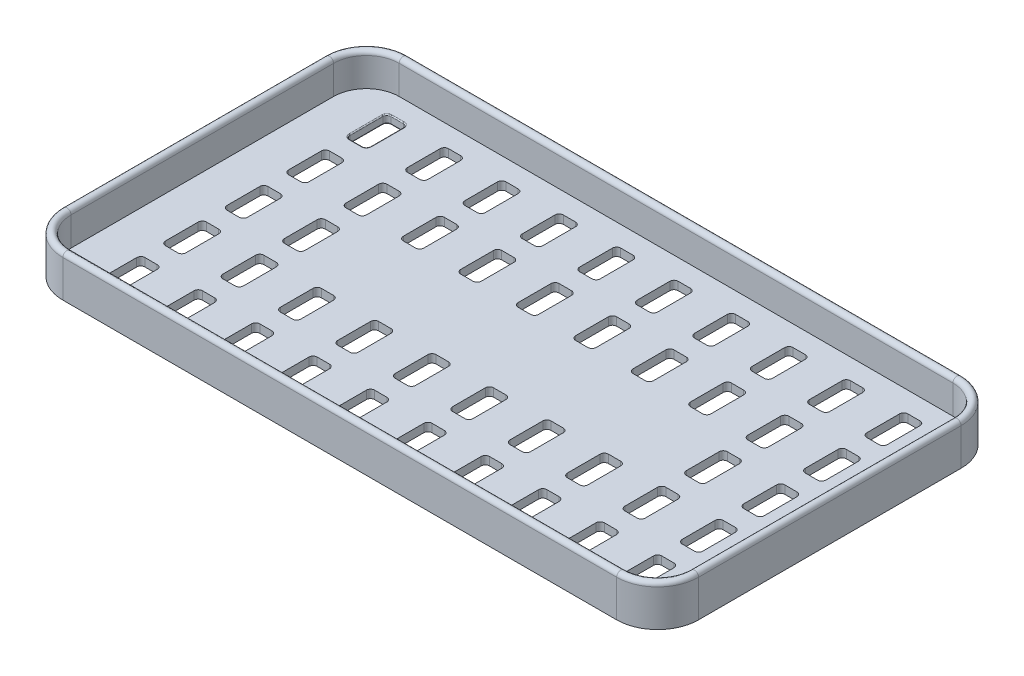
from build123d import *

# Parameters (mm, degrees)
SKETCH1_W              = 155
SKETCH1_H              = 84
BOSS_EXTRUDE1_DEPTH    = 10
FILLET1_R              = 10
SHELL1_T               = -2
SKETCH2_W              = 5
SKETCH2_H              = 10
CUT_EXTRUDE1_DEPTH     = 89.511298714
FILLET2_R              = 1
FILLET3_R              = 0.25
FILLET4_R              = 1
LPATTERN1_COUNT        = 10
LPATTERN1_PITCH        = 14
LPATTERN1_COUNT_DIR2   = 5
LPATTERN1_PITCH_DIR2   = 15
FILLET2_OF_LPATTERN1_R = 1


with BuildPart() as part:
    # Sketch1 → Boss-Extrude1 (new body)
    with BuildSketch(Plane(origin=(0, 0, 0), x_dir=(1, 0, 0), z_dir=(0, 1, 0))):
        Rectangle(SKETCH1_W, SKETCH1_H)
    extrude(amount=BOSS_EXTRUDE1_DEPTH)

    # Fillet1
    fillet1_edges = [part.edges().sort_by_distance(p)[0] for p in [
        (77.5, 5, 42),
        (-77.5, 5, 42),
        (-77.5, 5, -42),
        (77.5, 5, -42),
    ]]
    fillet(fillet1_edges, radius=FILLET1_R)

    # Shell1
    shell1_openings = [part.faces().sort_by_distance(p)[0] for p in [
        (0, 10, 0),
    ]]
    offset(amount=SHELL1_T, openings=shell1_openings, kind=Kind.INTERSECTION)

    # Sketch2 → Cut-Extrude1 (cut, through all)
    with BuildSketch(Plane(origin=(0, 2, 0), x_dir=(1, 0, 0), z_dir=(0, 1, 0))):
        with Locations((-63, 30)):
            Rectangle(SKETCH2_W, SKETCH2_H)
    cut_extrude1 = extrude(amount=-CUT_EXTRUDE1_DEPTH, mode=Mode.SUBTRACT)

    # Fillet2
    fillet2_edges = [part.edges().sort_by_distance(p)[0] for p in [
        (-60.5, 1, -35),
        (-60.5, 1, -25),
        (-65.5, 1, -25),
        (-65.5, 1, -35),
    ]]
    fillet(fillet2_edges, radius=FILLET2_R)

    # Fillet3
    fillet3_edges = [part.edges().sort_by_distance(p)[0] for p in [
        (-60.5, 2, -30),
        (-60.5, 0, -30),
        (-63, 2, -25),
        (-63, 0, -25),
        (-65.5, 2, -30),
        (-65.5, 0, -30),
        (-63, 2, -35),
        (-63, 0, -35),
        (-60.792893219, 2, -25.292893219),
        (-60.792893219, 0, -25.292893219),
        (-65.207106781, 2, -25.292893219),
        (-65.207106781, 0, -25.292893219),
        (-65.207106781, 2, -34.707106781),
        (-65.207106781, 0, -34.707106781),
        (-60.792893219, 2, -34.707106781),
        (-60.792893219, 0, -34.707106781),
    ]]
    fillet(fillet3_edges, radius=FILLET3_R)

    # Fillet4
    fillet4_edges = [part.edges().sort_by_distance(p)[0] for p in [
        (0, 10, 42),
        (-77.5, 10, 0),
        (77.5, 10, 0),
        (0, 10, -42),
        (74.571067812, 10, 39.071067812),
        (74.571067812, 10, -39.071067812),
        (-74.571067812, 10, -39.071067812),
        (-74.571067812, 10, 39.071067812),
        (-75.5, 10, 0),
        (0, 10, 40),
        (75.5, 10, 0),
        (0, 10, -40),
    ]]
    fillet(fillet4_edges, radius=FILLET4_R - 0.0001)  # a hair under: the kernel refuses the full size

    # LPattern1: Cut-Extrude1 10 × 5, 6 skipped
    with Locations(*[(i * LPATTERN1_PITCH, 0, j * LPATTERN1_PITCH_DIR2) for i in range(LPATTERN1_COUNT) for j in range(LPATTERN1_COUNT_DIR2) if (i, j) not in ((0, 0), (2, 2), (3, 2), (4, 2), (5, 2), (6, 2), (7, 2))]):
        add(cut_extrude1, mode=Mode.SUBTRACT)

    # Fillet2 of LPattern1
    fillet2_of_lpattern1_edges = [part.edges().sort_by_distance(p)[0] for p in [
        (-60.5, 1, -20),
        (-60.5, 1, -10),
        (-65.5, 1, -10),
        (-65.5, 1, -20),
        (-60.5, 1, -5),
        (-60.5, 1, 5),
        (-65.5, 1, 5),
        (-65.5, 1, -5),
        (-60.5, 1, 10),
        (-60.5, 1, 20),
        (-65.5, 1, 20),
        (-65.5, 1, 10),
        (-60.5, 1, 25),
        (-60.5, 1, 35),
        (-65.5, 1, 35),
        (-65.5, 1, 25),
        (-46.5, 1, -35),
        (-46.5, 1, -25),
        (-51.5, 1, -25),
        (-51.5, 1, -35),
        (-46.5, 1, -20),
        (-46.5, 1, -10),
        (-51.5, 1, -10),
        (-51.5, 1, -20),
        (-46.5, 1, -5),
        (-46.5, 1, 5),
        (-51.5, 1, 5),
        (-51.5, 1, -5),
        (-46.5, 1, 10),
        (-46.5, 1, 20),
        (-51.5, 1, 20),
        (-51.5, 1, 10),
        (-46.5, 1, 25),
        (-46.5, 1, 35),
        (-51.5, 1, 35),
        (-51.5, 1, 25),
        (-32.5, 1, -35),
        (-32.5, 1, -25),
        (-37.5, 1, -25),
        (-37.5, 1, -35),
        (-32.5, 1, -20),
        (-32.5, 1, -10),
        (-37.5, 1, -10),
        (-37.5, 1, -20),
        (-32.5, 1, 10),
        (-32.5, 1, 20),
        (-37.5, 1, 20),
        (-37.5, 1, 10),
        (-32.5, 1, 25),
        (-32.5, 1, 35),
        (-37.5, 1, 35),
        (-37.5, 1, 25),
        (-18.5, 1, -35),
        (-18.5, 1, -25),
        (-23.5, 1, -25),
        (-23.5, 1, -35),
        (-18.5, 1, -20),
        (-18.5, 1, -10),
        (-23.5, 1, -10),
        (-23.5, 1, -20),
        (-18.5, 1, 10),
        (-18.5, 1, 20),
        (-23.5, 1, 20),
        (-23.5, 1, 10),
        (-18.5, 1, 25),
        (-18.5, 1, 35),
        (-23.5, 1, 35),
        (-23.5, 1, 25),
        (-4.5, 1, -35),
        (-4.5, 1, -25),
        (-9.5, 1, -25),
        (-9.5, 1, -35),
        (-4.5, 1, -20),
        (-4.5, 1, -10),
        (-9.5, 1, -10),
        (-9.5, 1, -20),
        (-4.5, 1, 10),
        (-4.5, 1, 20),
        (-9.5, 1, 20),
        (-9.5, 1, 10),
        (-4.5, 1, 25),
        (-4.5, 1, 35),
        (-9.5, 1, 35),
        (-9.5, 1, 25),
        (9.5, 1, -35),
        (9.5, 1, -25),
        (4.5, 1, -25),
        (4.5, 1, -35),
        (9.5, 1, -20),
        (9.5, 1, -10),
        (4.5, 1, -10),
        (4.5, 1, -20),
        (9.5, 1, 10),
        (9.5, 1, 20),
        (4.5, 1, 20),
        (4.5, 1, 10),
        (9.5, 1, 25),
        (9.5, 1, 35),
        (4.5, 1, 35),
        (4.5, 1, 25),
        (23.5, 1, -35),
        (23.5, 1, -25),
        (18.5, 1, -25),
        (18.5, 1, -35),
        (23.5, 1, -20),
        (23.5, 1, -10),
        (18.5, 1, -10),
        (18.5, 1, -20),
        (23.5, 1, 10),
        (23.5, 1, 20),
        (18.5, 1, 20),
        (18.5, 1, 10),
        (23.5, 1, 25),
        (23.5, 1, 35),
        (18.5, 1, 35),
        (18.5, 1, 25),
        (37.5, 1, -35),
        (37.5, 1, -25),
        (32.5, 1, -25),
        (32.5, 1, -35),
        (37.5, 1, -20),
        (37.5, 1, -10),
        (32.5, 1, -10),
        (32.5, 1, -20),
        (37.5, 1, 10),
        (37.5, 1, 20),
        (32.5, 1, 20),
        (32.5, 1, 10),
        (37.5, 1, 25),
        (37.5, 1, 35),
        (32.5, 1, 35),
        (32.5, 1, 25),
        (51.5, 1, -35),
        (51.5, 1, -25),
        (46.5, 1, -25),
        (46.5, 1, -35),
        (51.5, 1, -20),
        (51.5, 1, -10),
        (46.5, 1, -10),
        (46.5, 1, -20),
        (51.5, 1, -5),
        (51.5, 1, 5),
        (46.5, 1, 5),
        (46.5, 1, -5),
        (51.5, 1, 10),
        (51.5, 1, 20),
        (46.5, 1, 20),
        (46.5, 1, 10),
        (51.5, 1, 25),
        (51.5, 1, 35),
        (46.5, 1, 35),
        (46.5, 1, 25),
        (65.5, 1, -35),
        (65.5, 1, -25),
        (60.5, 1, -25),
        (60.5, 1, -35),
        (65.5, 1, -20),
        (65.5, 1, -10),
        (60.5, 1, -10),
        (60.5, 1, -20),
        (65.5, 1, -5),
        (65.5, 1, 5),
        (60.5, 1, 5),
        (60.5, 1, -5),
        (65.5, 1, 10),
        (65.5, 1, 20),
        (60.5, 1, 20),
        (60.5, 1, 10),
        (65.5, 1, 25),
        (65.5, 1, 35),
        (60.5, 1, 35),
        (60.5, 1, 25),
    ]]
    fillet(fillet2_of_lpattern1_edges, radius=FILLET2_OF_LPATTERN1_R)


solid = part.part
